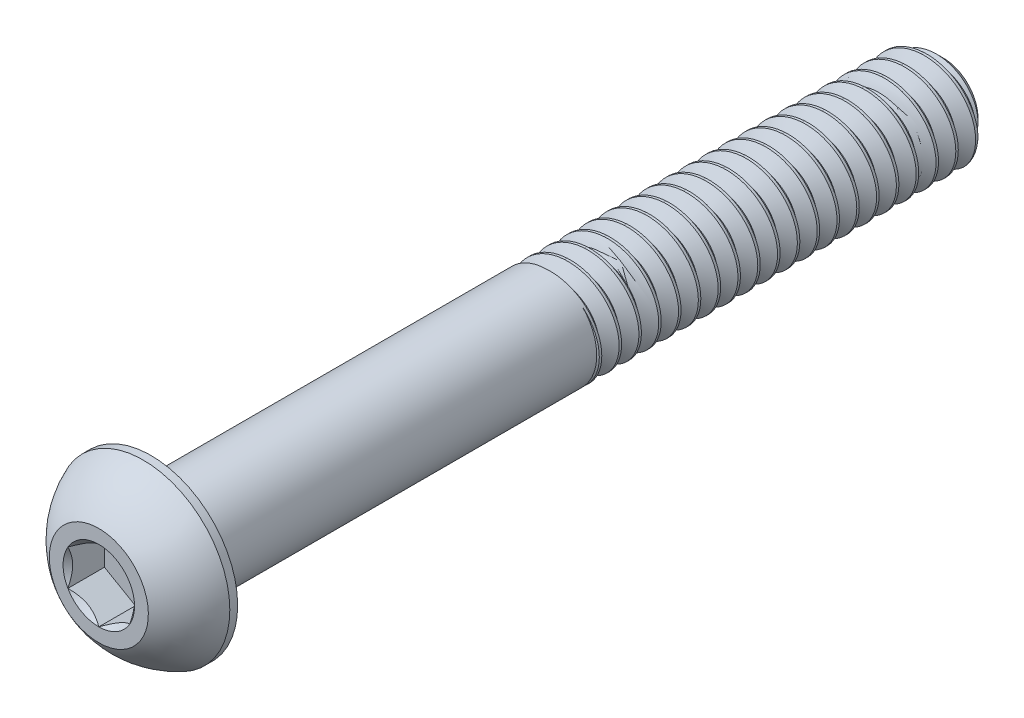
from build123d import *
from build123d.topology import SkipClean

# Parameters (mm, degrees)
SKETCH1_W           = 50.8
SKETCH1_H           = 3.175
CHAMFER1_SIZE       = 0.9525
CUT_SWEEP1_PITCH    = 1.27
CUT_EXTRUDE2_DEPTH  = 2.34696
BOSS_EXTRUDE2_START = -25.4
SKETCH9_R           = 3.175
BOSS_EXTRUDE2_DEPTH = 25.4


with BuildPart() as part:
    # Sketch1 → Revolve1 (revolve)
    with BuildSketch(Plane(origin=(0, 0, 0), x_dir=(0, 0, -1), z_dir=(1, 0, 0))):
        with Locations((28.7528, 1.5875)):
            Rectangle(SKETCH1_W, SKETCH1_H)
    revolve(axis=Axis((0, 0, -54.1528), (0, 0, 1)))

    # Chamfer1
    chamfer1_edges = [part.edges().sort_by_distance(p)[0] for p in [
        (0, -3.175, -54.1528),
    ]]
    chamfer(chamfer1_edges, length=CHAMFER1_SIZE)

    # Cut-Sweep1: arcs per turn and ends read off the stored shape
    # Cut-Sweep1: the profile of Sketch2 profile screwed along a right-hand helix through 41 turns, 8 arcs to a turn; built about Z, then put on its axis
    cut_sweep1_z = Axis((0, 0, 0), (0, 0, 1))
    cut_sweep1_corners = [(3.1753, 0, 0.000173205), (3.1753, 0, -1.111423205), (2.350110803, 0, -0.635), (2.350110803, 0, -0.47625)]
    with BuildLine(mode=Mode.PRIVATE) as cut_sweep1_profile:
        Line(cut_sweep1_corners[0], cut_sweep1_corners[1])
        Line(cut_sweep1_corners[1], cut_sweep1_corners[2])
        Line(cut_sweep1_corners[2], cut_sweep1_corners[3])
        Line(cut_sweep1_corners[3], cut_sweep1_corners[0])
    cut_sweep1_cap = Face(cut_sweep1_profile.wire())
    cut_sweep1_turn_angles = [0, 22.5, 45, 67.5, 90, 112.5, 135, 157.5, 180, 202.5, 225, 247.5, 270, 292.5, 315, 337.5, 360]
    cut_sweep1_turn_weights = [1, 0.9238795325112867, 1, 0.9238795325112867, 1, 0.9238795325112867, 1, 0.9238795325112867, 1, 0.9238795325112867, 1, 0.9238795325112867, 1, 0.9238795325112867, 1, 0.9238795325112867, 1]
    cut_sweep1_turn_rails = [Edge.make_bspline([Vector(p[0], p[1], 0).rotate(cut_sweep1_z, cut_sweep1_turn_angles[k]) / cut_sweep1_turn_weights[k] + Vector(0, 0, p[2] + CUT_SWEEP1_PITCH * cut_sweep1_turn_angles[k] / 360) for k in range(17)], [0, 0, 0, 1, 1, 2, 2, 3, 3, 4, 4, 5, 5, 6, 6, 7, 7, 8, 8, 8], 2, cut_sweep1_turn_weights) for p in cut_sweep1_corners]
    cut_sweep1_turn_sides = [Face.make_surface_from_curves(cut_sweep1_turn_rails[p[0]], cut_sweep1_turn_rails[p[1]]) for p in [(0, 1), (1, 2), (2, 3), (3, 0)]]
    cut_sweep1 = Plane(origin=(0, 0, -54.1528), x_dir=(0, 1, 0), z_dir=(0, 0, 1)) * Solid(Shell([*[p.moved(Location((0, 0, CUT_SWEEP1_PITCH * i))) for i in range(41) for p in cut_sweep1_turn_sides], cut_sweep1_cap, cut_sweep1_cap.rotate(cut_sweep1_z, 14760).moved(Location((0, 0, CUT_SWEEP1_PITCH * 14760 / 360)))]))
    add(cut_sweep1, mode=Mode.SUBTRACT)

    # Sketch7 → Revolve2 (revolve)
    with BuildSketch(Plane(origin=(0, 0, 0), x_dir=(0, 0, -1), z_dir=(1, 0, 0)), mode=Mode.PRIVATE) as revolve2_sk:
        with BuildLine():
            Line((2.84988, 5.5499), (3.3528, 5.5499))
            Line((3.3528, 5.5499), (3.3528, 0))
            Line((3.3528, 0), (0, 0))
            Line((0, 0), (0, 3.175))
            ThreePointArc((0, 3.175), (1.235921075, 4.58927271), (2.84988, 5.5499))
        make_face()
    revolve(revolve2_sk.sketch.rotate(Axis((0, 0, 0), (0, 0, -1)), 189.052465709), axis=Axis((0, 0, 0), (0, 0, -1)))

    # Sketch5 → Cut-Extrude2 (cut)
    with BuildSketch(Plane.XY):
        Polygon((1.984375, -1.14567944), (1.984375, 1.14567944), (0, 2.291358881), (-1.984375, 1.14567944), (-1.984375, -1.14567944), (0, -2.291358881), align=None)
    extrude(amount=-CUT_EXTRUDE2_DEPTH, mode=Mode.SUBTRACT)

    # Cut-Extrude3 cone 1 section (through the dimple's axis) → Cut-Extrude3 (revolve, cut)
    with BuildSketch(Plane(origin=(0, 0, 0), x_dir=(0, -1, 0), z_dir=(1, 0, 0))):
        Polygon((0, 0), (2.291358881, 0), (0, 2.291358881), align=None)
    revolve(axis=Axis((0, 0, 0), (0, 0, -1)), mode=Mode.SUBTRACT)

    # Sketch9 → Boss-Extrude2 (add)
    with SkipClean():  # the faces are left unmerged after this step: merging them gives an invalid solid
        with BuildSketch(Plane.XY.offset(-3.3528).offset(BOSS_EXTRUDE2_START)):
            with Locations(Location((0, 0, 0), (0, 0, 90))):
                Circle(SKETCH9_R)
        extrude(amount=BOSS_EXTRUDE2_DEPTH)


solid = part.part
